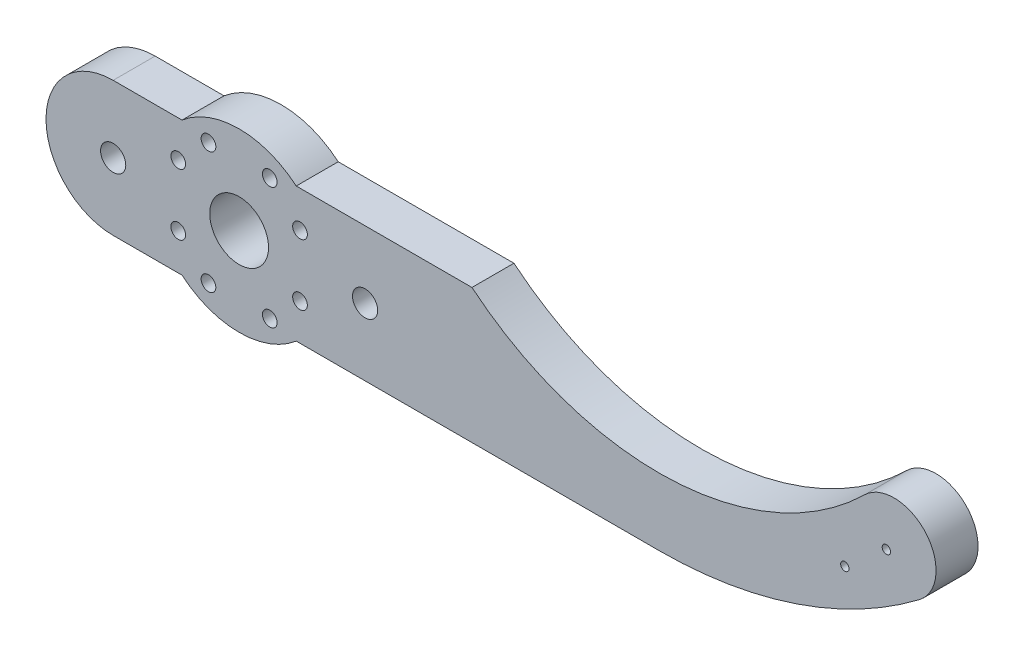
from build123d import *

# Parameters (mm, degrees)
ESQUISSE1_R        = 0.5
ESQUISSE1_R_2      = 1.5
ESQUISSE1_R_3      = 3.5
ESQUISSE1_R_4      = 0.875
BOSS_EXTRU_1_DEPTH = 5


with BuildPart() as part:
    # Esquisse1 → Boss.-Extru.1 (new body)
    with BuildSketch(Plane.XY):
        with BuildLine():
            Line((6.800735254, 8), (20, 8))
            Line((20, 8), (27.728942549, 8))
            ThreePointArc((27.728942549, 8), (51.499017336, 0.032115491), (74.5, 10.0050005))
            ThreePointArc((74.5, 10.0050005), (81.783026213, 9.703645958), (81.02586797, 2.453818596))
            ThreePointArc((81.02586797, 2.453818596), (66.369841222, -5.316304031), (50, -8))
            Line((50, -8), (6.800735254, -8))
            ThreePointArc((6.800735254, -8), (0, -10.5), (-6.800735254, -8))
            Line((-6.800735254, -8), (-15, -8))
            ThreePointArc((-15, -8), (-23, 0), (-15, 8))
            Line((-15, 8), (-6.800735254, 8))
            ThreePointArc((-6.800735254, 8), (0, 10.5), (6.800735254, 8))
        make_face()
        with Locations((77.084290067, 5.654211565)):
            Circle(ESQUISSE1_R, mode=Mode.SUBTRACT)
        with Locations((15, 0)):
            Circle(ESQUISSE1_R_2, mode=Mode.SUBTRACT)
        with Locations((-15, 0)):
            Circle(ESQUISSE1_R_2, mode=Mode.SUBTRACT)
        Circle(ESQUISSE1_R_3, mode=Mode.SUBTRACT)
        with Locations((72.136277137, 1.439099698)):
            Circle(ESQUISSE1_R, mode=Mode.SUBTRACT)
        with Locations((7.25, 3.65)):
            Circle(ESQUISSE1_R_4, mode=Mode.SUBTRACT)
        with Locations((7.25, -3.65)):
            Circle(ESQUISSE1_R_4, mode=Mode.SUBTRACT)
        with Locations((3.65, -7.25)):
            Circle(ESQUISSE1_R_4, mode=Mode.SUBTRACT)
        with Locations((-3.65, -7.25)):
            Circle(ESQUISSE1_R_4, mode=Mode.SUBTRACT)
        with Locations((-7.25, -3.65)):
            Circle(ESQUISSE1_R_4, mode=Mode.SUBTRACT)
        with Locations((-7.25, 3.65)):
            Circle(ESQUISSE1_R_4, mode=Mode.SUBTRACT)
        with Locations((-3.65, 7.25)):
            Circle(ESQUISSE1_R_4, mode=Mode.SUBTRACT)
        with Locations((3.65, 7.25)):
            Circle(ESQUISSE1_R_4, mode=Mode.SUBTRACT)
    extrude(amount=BOSS_EXTRU_1_DEPTH)


solid = part.part
